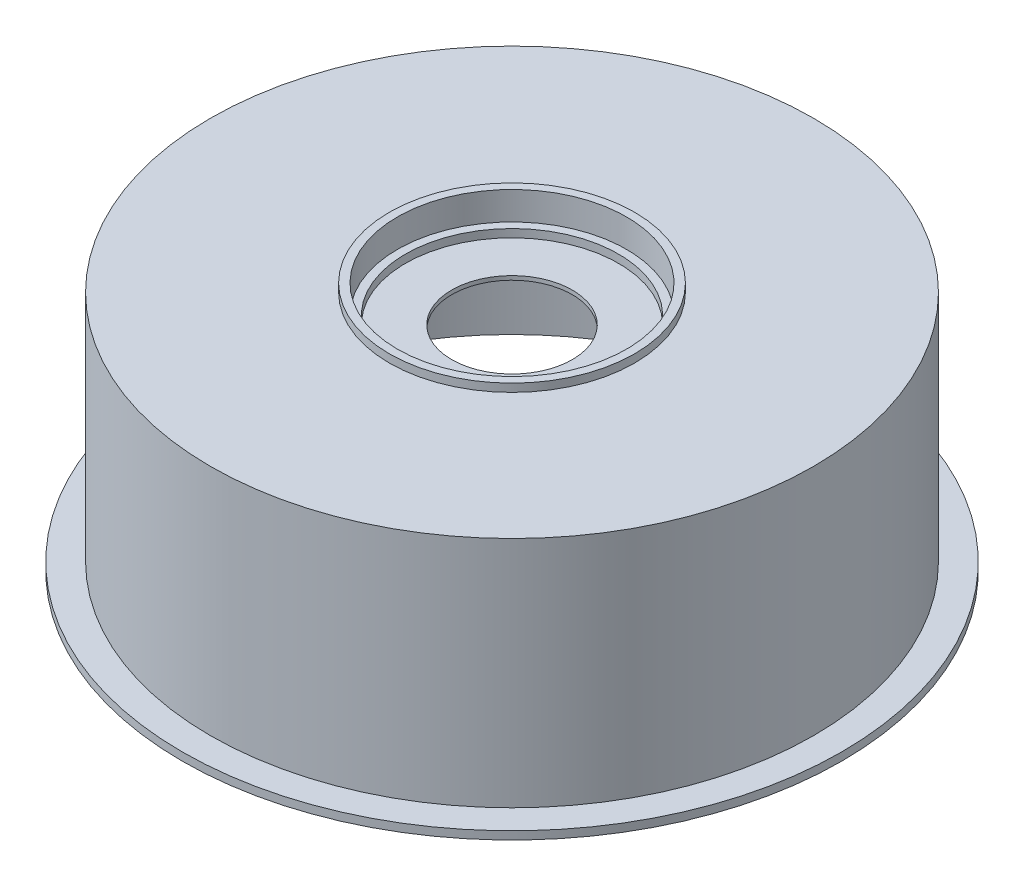
from build123d import *

# Parameters (mm, degrees)
SKETCH_1_R          = 75
EXTRUDE_1_DEPTH     = 8
EXTRUDE_START       = 50
SKETCH_2_R          = 75
SKETCH_2_R_2        = 72
EXTRUDE_2_DEPTH     = 50
EXTRUDE_START_2     = 2
SKETCH_3_R          = 82
SKETCH_3_R_2        = 72
EXTRUDE_3_DEPTH     = 2
SKETCH_4_R          = 30.5
SKETCH_4_R_2        = 28.5
EXTRUDE_4_DEPTH     = 2
CUT_EXTRUDE_START   = -5
SKETCH_5_R          = 28.5
CUT_EXTRUDE_1_DEPTH = 5
SKETCH_6_R          = 26.5
CUT_EXTRUDE_2_DEPTH = 2
CUT_EXTRUDE_3_REACH = 129.503
SKETCH_7_R          = 15
EXTRUDE_6_DEPTH     = 17.7
SKETCH_10_R         = 1.35
CUT_EXTRUDE_4_DEPTH = 10


# Read off the part's stored shape, not the designer's step: 보스-돌출6
with BuildPart() as part:
    # 스케치1 → 보스-돌출1 (new body)
    with BuildSketch(Plane(origin=(0, 0, 0), x_dir=(1, 0, 0), z_dir=(0, 1, 0))):
        with Locations(Location((0, 0, 0), (0, 0, 270))):
            Circle(SKETCH_1_R)
    extrude(amount=EXTRUDE_1_DEPTH)

    # 스케치2 → 보스-돌출2 (add)
    with BuildSketch(Plane.XZ.offset(EXTRUDE_START)):
        with Locations(Location((0, 0, 0), (0, 0, 270))):
            Circle(SKETCH_2_R)
        with Locations(Location((0, 0, 0), (0, 0, 270))):
            Circle(SKETCH_2_R_2, mode=Mode.SUBTRACT)
    extrude(amount=-EXTRUDE_2_DEPTH)

    # 스케치3 → 보스-돌출3 (add)
    with BuildSketch(Plane.XZ.offset(50).offset(EXTRUDE_START_2)):
        with Locations(Location((0, 0, 0), (0, 0, 270))):
            Circle(SKETCH_3_R)
        with Locations(Location((0, 0, 0), (0, 0, 270))):
            Circle(SKETCH_3_R_2, mode=Mode.SUBTRACT)
    extrude(amount=-EXTRUDE_3_DEPTH)

    # 스케치4 → 보스-돌출4 (add)
    with BuildSketch(Plane(origin=(0, 8, 0), x_dir=(1, 0, 0), z_dir=(0, 1, 0))):
        with Locations(Location((0, 0, 0), (0, 0, 270))):
            Circle(SKETCH_4_R)
        with Locations(Location((0, 0, 0), (0, 0, 270))):
            Circle(SKETCH_4_R_2, mode=Mode.SUBTRACT)
    extrude(amount=EXTRUDE_4_DEPTH)

    # 스케치5 → 컷-돌출1 (cut)
    with BuildSketch(Plane(origin=(0, 8, 0), x_dir=(1, 0, 0), z_dir=(0, 1, 0)).offset(CUT_EXTRUDE_START)):
        with Locations(Location((0, 0, 0), (0, 0, 270))):
            Circle(SKETCH_5_R)
    extrude(amount=CUT_EXTRUDE_1_DEPTH, mode=Mode.SUBTRACT)

    # 스케치6 → 컷-돌출2 (cut)
    with BuildSketch(Plane(origin=(0, 3, 0), x_dir=(1, 0, 0), z_dir=(0, 1, 0))):
        with Locations(Location((0, 0, 0), (0, 0, 270))):
            Circle(SKETCH_6_R)
    extrude(amount=-CUT_EXTRUDE_2_DEPTH, mode=Mode.SUBTRACT)

    # 스케치7 → 컷-돌출3 (cut, up to next)
    with BuildSketch(Plane(origin=(0, 1, 0), x_dir=(1, 0, 0), z_dir=(0, 1, 0)), mode=Mode.PRIVATE) as cut_extrude_3_sk1:
        with Locations(Location((0, 0, 0), (0, 0, 270))):
            Circle(SKETCH_7_R)
    cut_extrude_3_tool1 = extrude(cut_extrude_3_sk1.sketch, amount=-CUT_EXTRUDE_3_REACH, mode=Mode.PRIVATE) & part.part
    add(cut_extrude_3_tool1.solids().sort_by_distance((0, 1, 0))[0], mode=Mode.SUBTRACT)


with BuildPart() as body_2:
    # 보스-돌출6 outline → 보스-돌출6 (new body)
    with BuildSketch(Plane.XZ):
        with BuildLine():
            Line((57, 25.5), (57, -25.5))
            Line((57, -25.5), (67.333127062, -25.5))
            ThreePointArc((67.333127062, -25.5), (72, 0), (67.333127062, 25.5))
            Line((67.333127062, 25.5), (57, 25.5))
        make_face()
        with BuildLine():
            Line((-67.333127062, -25.5), (-57, -25.5))
            Line((-57, -25.5), (-57, 25.5))
            Line((-57, 25.5), (-67.333127062, 25.5))
            ThreePointArc((-67.333127062, 25.5), (-72, 0), (-67.333127062, -25.5))
        make_face()
    extrude(amount=EXTRUDE_6_DEPTH)

    # 스케치10 → 컷-돌출4 (cut)
    with BuildSketch(Plane.XZ.offset(17.7)):
        with Locations(Location((-62, 15.5, 0), (0, 0, 270))):
            Circle(SKETCH_10_R)
        with Locations(Location((-62, -15.5, 0), (0, 0, 270))):
            Circle(SKETCH_10_R)
        with Locations(Location((62, 15.5, 0), (0, 0, 270))):
            Circle(SKETCH_10_R)
        with Locations(Location((62, -15.5, 0), (0, 0, 270))):
            Circle(SKETCH_10_R)
    extrude(amount=-CUT_EXTRUDE_4_DEPTH, mode=Mode.SUBTRACT)


solid = Compound([part.part, body_2.part])
